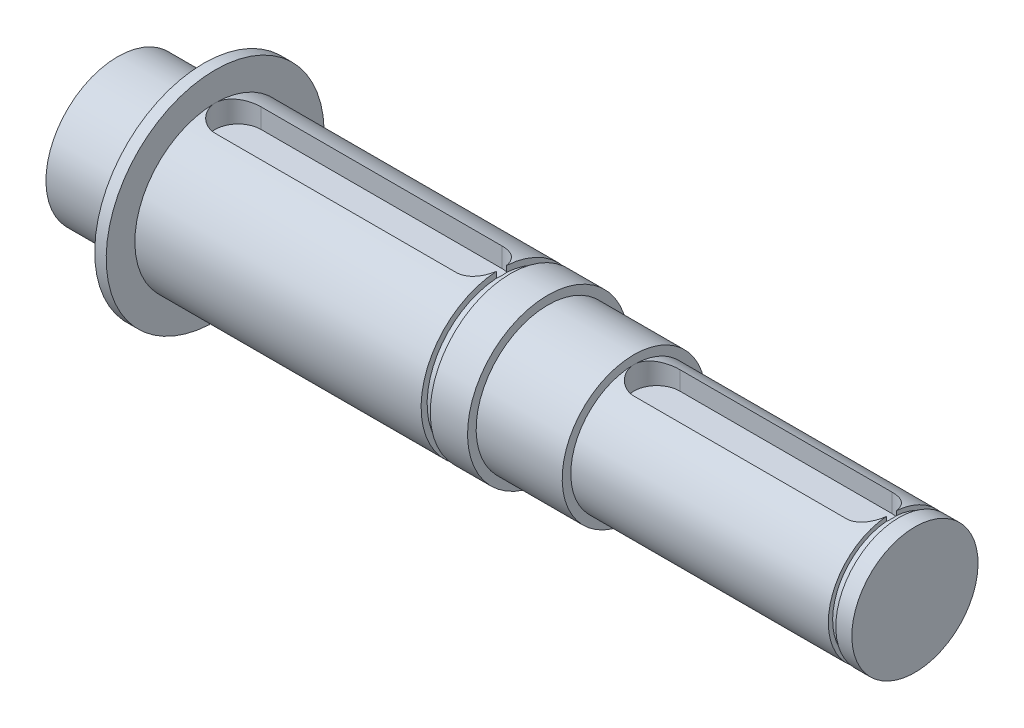
from build123d import *

# Parameters (mm, degrees)
CUT_EXTRUDE_START   = 10
CUT_EXTRUDE_1_DEPTH = 132.573302568
CUT_EXTRUDE_START_2 = 7
CUT_EXTRUDE_2_DEPTH = 135.573302568
CUT_EXTRUDE_START_3 = 68.5
SKETCH_4_R          = 14
SKETCH_4_R_2        = 12.95
CUT_EXTRUDE_3_DEPTH = 1.6
CUT_EXTRUDE_START_4 = 136.2
SKETCH_5_R          = 11
SKETCH_5_R_2        = 10.25
CUT_EXTRUDE_4_DEPTH = 1.3


with BuildPart() as part:
    # Эскиз1 → Повернуть1 (revolve)
    with BuildSketch(Plane.XY):
        Polygon((0, 0), (0, 12.5), (15, 12.5), (15, 14), (15, 19), (17, 19), (17, 14), (75, 14), (75, 12.5), (90, 12.5), (90, 11), (139, 11), (139, 0), align=None)
    revolve(axis=Axis((139, 0, 0), (-1, 0, 0)))

    # Эскиз2 → Вырез-Вытянуть1 (cut, through all)
    with BuildSketch(Plane(origin=(0, 0, 0), x_dir=(1, 0, 0), z_dir=(0, 1, 0)).offset(CUT_EXTRUDE_START)):
        with BuildLine():
            Line((21, 4), (63, 4))
            ThreePointArc((63, 4), (67, 0), (63, -4))
            Line((63, -4), (21, -4))
            ThreePointArc((21, -4), (17, 0), (21, 4))
        make_face()
    extrude(amount=CUT_EXTRUDE_1_DEPTH, mode=Mode.SUBTRACT)

    # Эскиз3 → Вырез-Вытянуть2 (cut, through all)
    with BuildSketch(Plane(origin=(0, 0, 0), x_dir=(1, 0, 0), z_dir=(0, 1, 0)).offset(CUT_EXTRUDE_START_2)):
        with BuildLine():
            Line((94, 4), (131, 4))
            ThreePointArc((131, 4), (135, 0), (131, -4))
            Line((131, -4), (94, -4))
            ThreePointArc((94, -4), (90, 0), (94, 4))
        make_face()
    extrude(amount=CUT_EXTRUDE_2_DEPTH, mode=Mode.SUBTRACT)

    # Эскиз4 → Вырез-Вытянуть3 (cut)
    with BuildSketch(Plane(origin=(0, 0, 0), x_dir=(0, 0, -1), z_dir=(1, 0, 0)).offset(CUT_EXTRUDE_START_3)):
        Circle(SKETCH_4_R)
        Circle(SKETCH_4_R_2, mode=Mode.SUBTRACT)
    extrude(amount=-CUT_EXTRUDE_3_DEPTH, mode=Mode.SUBTRACT)

    # Эскиз5 → Вырез-Вытянуть4 (cut)
    with BuildSketch(Plane(origin=(0, 0, 0), x_dir=(0, 0, -1), z_dir=(1, 0, 0)).offset(CUT_EXTRUDE_START_4)):
        Circle(SKETCH_5_R)
        Circle(SKETCH_5_R_2, mode=Mode.SUBTRACT)
    extrude(amount=-CUT_EXTRUDE_4_DEPTH, mode=Mode.SUBTRACT)


solid = part.part
